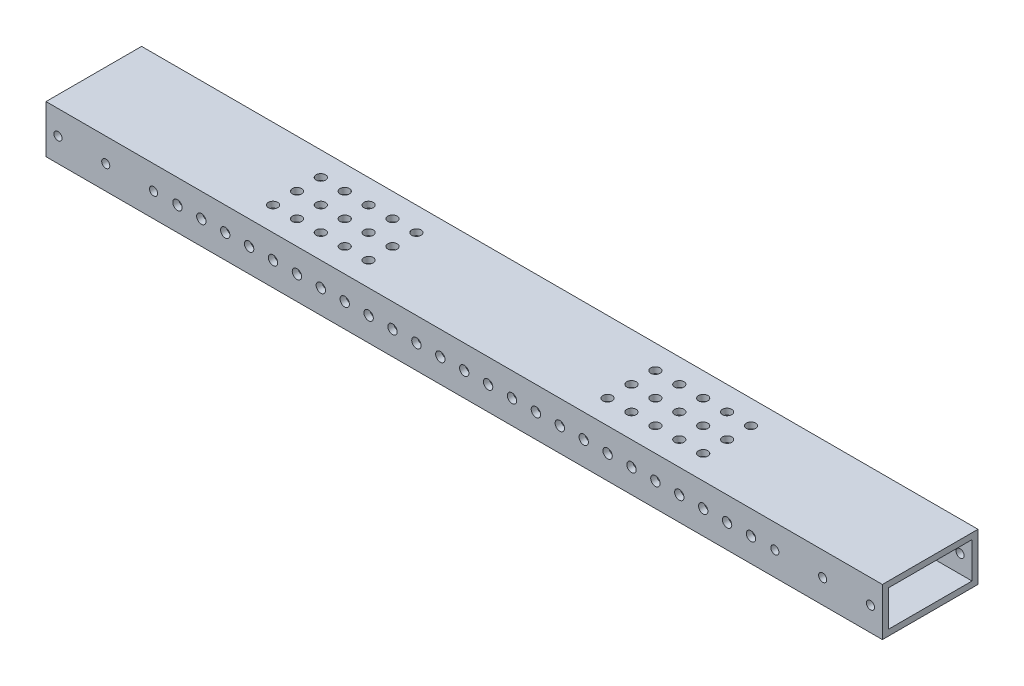
from build123d import *

# Parameters (mm, degrees)
SKETCH1_W           = 50.8
SKETCH1_H           = 25.4
BOSS_EXTRUDE1_DEPTH = 222.25
SHELL1_T            = -3.175
SKETCH2_R           = 2.15265
CUT_EXTRUDE1_DEPTH  = 230.392376726
SKETCH3_R           = 2.4892
CUT_EXTRUDE2_DEPTH  = 230.392376726
LPATTERN1_COUNT     = 25
LPATTERN1_PITCH     = 12.7
SKETCH6_R           = 2.4892
CUT_EXTRUDE3_DEPTH  = 230.392376726


with BuildPart() as part:
    # Sketch1 → Boss-Extrude1 (new, symmetric)
    with BuildSketch(Plane(origin=(0, 0, 0), x_dir=(0, 0, -1), z_dir=(1, 0, 0))):
        with Locations((25.4, 12.7)):
            Rectangle(SKETCH1_W, SKETCH1_H)
    extrude(amount=BOSS_EXTRUDE1_DEPTH, both=True)

    # Shell1
    shell1_openings = [part.faces().sort_by_distance(p)[0] for p in [
        (222.25, 12.7, -25.4),
        (-222.25, 12.7, -25.4),
    ]]
    offset(amount=SHELL1_T, openings=shell1_openings, kind=Kind.INTERSECTION)

    # Sketch2 → Cut-Extrude1 (cut, through all)
    with BuildSketch(Plane.XY):
        with Locations((-215.9, 12.7)):
            Circle(SKETCH2_R)
        with Locations((-190.5, 12.7)):
            Circle(SKETCH2_R)
        with Locations((-165.1, 12.7)):
            Circle(SKETCH2_R)
    cut_extrude1 = extrude(amount=-CUT_EXTRUDE1_DEPTH, mode=Mode.SUBTRACT)

    # Sketch3 → Cut-Extrude2 (cut, through all)
    with BuildSketch(Plane.XY):
        with Locations((-152.4, 12.7)):
            Circle(SKETCH3_R)
    cut_extrude2 = extrude(amount=-CUT_EXTRUDE2_DEPTH, mode=Mode.SUBTRACT)

    # Mirror1: Cut-Extrude1 across plane
    add(cut_extrude1.mirror(Plane(origin=(0, 0, 0), x_dir=(0, 0, 1), z_dir=(1, 0, 0))), mode=Mode.SUBTRACT)

    # LPattern1: Cut-Extrude2 ×25
    with Locations(*[(i * LPATTERN1_PITCH, 0, 0) for i in range(1, LPATTERN1_COUNT)]):
        add(cut_extrude2, mode=Mode.SUBTRACT)

    # Sketch6 → Cut-Extrude3 (cut, through all)
    with BuildSketch(Plane.XZ):
        with Locations((63.5, -12.7)):
            Circle(SKETCH6_R)
        with Locations((63.5, -25.4)):
            Circle(SKETCH6_R)
        with Locations((76.2, -25.4)):
            Circle(SKETCH6_R)
        with Locations((76.2, -12.7)):
            Circle(SKETCH6_R)
        with Locations((88.9, -12.7)):
            Circle(SKETCH6_R)
        with Locations((101.6, -25.4)):
            Circle(SKETCH6_R)
        with Locations((88.9, -25.4)):
            Circle(SKETCH6_R)
        with Locations((101.6, -12.7)):
            Circle(SKETCH6_R)
        with Locations((114.3, -12.7)):
            Circle(SKETCH6_R)
        with Locations((114.3, -25.4)):
            Circle(SKETCH6_R)
        with Locations((114.3, -38.1)):
            Circle(SKETCH6_R)
        with Locations((101.6, -38.1)):
            Circle(SKETCH6_R)
        with Locations((88.9, -38.1)):
            Circle(SKETCH6_R)
        with Locations((76.2, -38.1)):
            Circle(SKETCH6_R)
        with Locations((63.5, -38.1)):
            Circle(SKETCH6_R)
        with Locations((-114.3, -12.7)):
            Circle(SKETCH6_R)
        with Locations((-101.6, -12.7)):
            Circle(SKETCH6_R)
        with Locations((-88.9, -12.7)):
            Circle(SKETCH6_R)
        with Locations((-76.2, -12.7)):
            Circle(SKETCH6_R)
        with Locations((-63.5, -12.7)):
            Circle(SKETCH6_R)
        with Locations((-63.5, -25.4)):
            Circle(SKETCH6_R)
        with Locations((-76.2, -25.4)):
            Circle(SKETCH6_R)
        with Locations((-88.9, -25.4)):
            Circle(SKETCH6_R)
        with Locations((-101.6, -25.4)):
            Circle(SKETCH6_R)
        with Locations((-114.3, -25.4)):
            Circle(SKETCH6_R)
        with Locations((-114.3, -38.1)):
            Circle(SKETCH6_R)
        with Locations((-101.6, -38.1)):
            Circle(SKETCH6_R)
        with Locations((-88.9, -38.1)):
            Circle(SKETCH6_R)
        with Locations((-76.2, -38.1)):
            Circle(SKETCH6_R)
        with Locations((-63.5, -38.1)):
            Circle(SKETCH6_R)
    extrude(amount=-CUT_EXTRUDE3_DEPTH, mode=Mode.SUBTRACT)


solid = part.part
